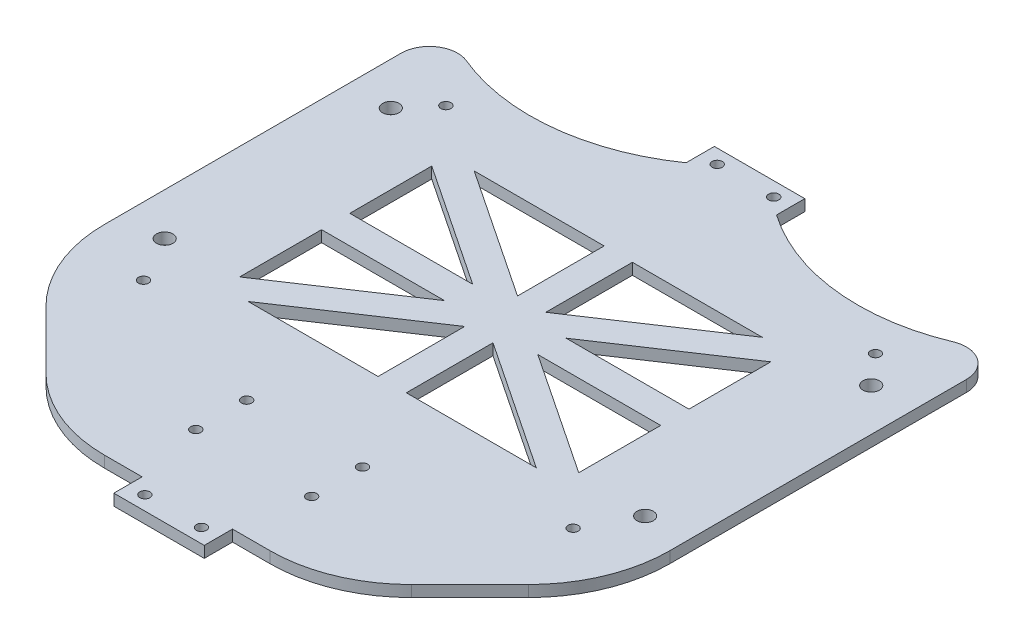
from build123d import *

# Parameters (mm, degrees)
BOSS_EXTRUDE1_DEPTH      = 4
M5_CLEARANCE_HOLE1_D     = 5.8
FILLET1_R                = 10
M3_CLEARANCE_HOLE1_D     = 3.6
M3_CLEARANCE_HOLE1_DEPTH = 10
M3_CLEARANCE_HOLE1_TIP   = 1.081549114
CHAMFER1_SIZE            = 50
FILLET3_R                = 50
M3_CLEARANCE_HOLE2_D     = 3.6


with BuildPart() as part:
    # Sketch1 → Boss-Extrude1 (new body)
    with BuildSketch(Plane(origin=(0, 0, 0), x_dir=(1, 0, 0), z_dir=(0, 1, 0))):
        with BuildLine():
            Line((-100, -29.5), (-100, -222))
            Line((-100, -222), (-16, -222))
            Line((-16, -222), (-16, -232))
            Line((-16, -232), (16, -232))
            Line((16, -232), (16, -222))
            Line((16, -222), (100, -222))
            Line((100, -222), (100, -29.5))
            ThreePointArc((100, -29.5), (58, -42.739333694), (16, -29.5))
            Line((16, -29.5), (16, -19.5))
            Line((16, -19.5), (-16, -19.5))
            Line((-16, -19.5), (-16, -29.5))
            ThreePointArc((-16, -29.5), (-58, -42.739333694), (-100, -29.5))
        make_face()
        Polygon((-60, -143.490747874), (-60, -114.5), (-16.513878189, -114.5), align=None, mode=Mode.SUBTRACT)
        Polygon((-5, -149.5), (-50.986121811, -149.5), (-5, -118.842585459), align=None, mode=Mode.SUBTRACT)
        Polygon((50.986121811, -149.5), (5, -149.5), (5, -118.842585459), align=None, mode=Mode.SUBTRACT)
        Polygon((60, -114.5), (60, -143.490747874), (16.513878189, -114.5), align=None, mode=Mode.SUBTRACT)
        Polygon((60, -75.509252126), (60, -104.5), (16.513878189, -104.5), align=None, mode=Mode.SUBTRACT)
        Polygon((5, -69.5), (50.986121811, -69.5), (5, -100.157414541), align=None, mode=Mode.SUBTRACT)
        Polygon((-50.986121811, -69.5), (-5, -69.5), (-5, -100.157414541), align=None, mode=Mode.SUBTRACT)
        Polygon((-60, -104.5), (-60, -75.509252126), (-16.513878189, -104.5), align=None, mode=Mode.SUBTRACT)
    extrude(amount=BOSS_EXTRUDE1_DEPTH)

    # M5 Clearance Hole1 (through all)
    with Locations(Plane(origin=(0, 4, 0), x_dir=(1, 0, 0), z_dir=(0, 1, 0))):
        with Locations((-85, -65), (-85, -145), (85, -145), (85, -65)):
            Hole(M5_CLEARANCE_HOLE1_D / 2)

    # Fillet1
    fillet1_edges = [part.edges().sort_by_distance(p)[0] for p in [
        (100, 2, 29.5),
        (-100, 2, 29.5),
    ]]
    fillet(fillet1_edges, radius=FILLET1_R)

    # M3 Clearance Hole1
    with Locations(Plane(origin=(0, 4, 0), x_dir=(1, 0, 0), z_dir=(0, 1, 0))):
        with Locations((-21, -198), (-21, -180), (20, -180), (20, -198)):
            Hole(M3_CLEARANCE_HOLE1_D / 2, depth=M3_CLEARANCE_HOLE1_DEPTH)
            with Locations((0, 0, -(M3_CLEARANCE_HOLE1_DEPTH + M3_CLEARANCE_HOLE1_TIP / 2))):  # 118° drill point
                Cone(0, M3_CLEARANCE_HOLE1_D / 2, M3_CLEARANCE_HOLE1_TIP, mode=Mode.SUBTRACT)

    # Chamfer1
    chamfer1_edges = [part.edges().sort_by_distance(p)[0] for p in [
        (100, 2, 222),
        (-100, 2, 222),
    ]]
    chamfer(chamfer1_edges, length=CHAMFER1_SIZE)

    # Fillet3
    fillet3_edges = [part.edges().sort_by_distance(p)[0] for p in [
        (-100, 2, 172),
        (-50, 2, 222),
        (100, 2, 172),
        (50, 2, 222),
    ]]
    fillet(fillet3_edges, radius=FILLET3_R)

    # M3 Clearance Hole2 (through all)
    with Locations(Plane(origin=(0, 4, 0), x_dir=(1, 0, 0), z_dir=(0, 1, 0))):
        with Locations((-76, -54.5), (76, -54.5), (76, -161.5), (-76, -161.5), (-10, -24.5), (10, -24.5), (-10, -227), (10, -227)):
            Hole(M3_CLEARANCE_HOLE2_D / 2)


solid = part.part
